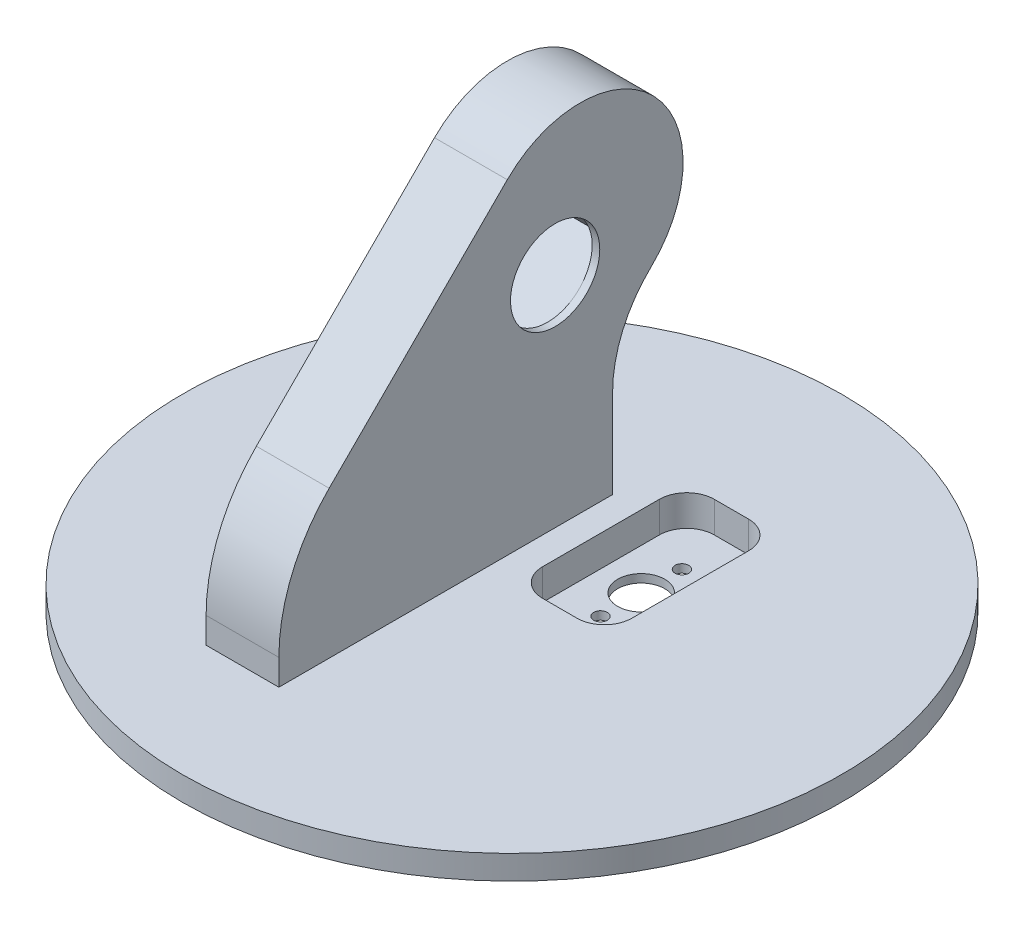
from build123d import *

# Parameters (mm, degrees)
SKETCH2_R           = 48
BOSS_EXTRUDE1_DEPTH = 3.5
BOSS_EXTRUDE2_DEPTH = 10.6
SKETCH31_R          = 6.5
CUT_EXTRUDE18_DEPTH = 94.671540859
CUT_EXTRUDE19_DEPTH = 9.5
SKETCH32_R          = 1
CUT_EXTRUDE20_DEPTH = 4.5
SKETCH33_R          = 43.5
BOSS_EXTRUDE3_DEPTH = 2.2
SKETCH34_W          = 13
SKETCH34_H          = 25
CUT_EXTRUDE21_DEPTH = 4.5
SKETCH35_R          = 3.43
CUT_EXTRUDE22_DEPTH = 146.83305399
FILLET1_R           = 4
SKETCH36_R          = 1
CUT_EXTRUDE23_DEPTH = 10


with BuildPart() as part:
    # Sketch2 → Boss-Extrude1 (new body)
    with BuildSketch(Plane(origin=(0, 0, 0), x_dir=(1, 0, 0), z_dir=(0, 1, 0))):
        Circle(SKETCH2_R)
    extrude(amount=BOSS_EXTRUDE1_DEPTH)

    # Sketch7 → Boss-Extrude2 (add)
    with BuildSketch(Plane(origin=(-4, 0, 0), x_dir=(0, 0, -1), z_dir=(1, 0, 0))):
        with BuildLine():
            Line((18.652115716, 3.5), (18.652115716, 16.356133126))
            ThreePointArc((18.652115716, 16.356133126), (20.111216245, 23.455333411), (24.251965127, 29.403595153))
            ThreePointArc((24.251965127, 29.403595153), (24.659117989, 50.747356958), (3.311904584, 50.883081894))
            Line((3.311904584, 50.883081894), (-22.631121669, 24.94005564))
            ThreePointArc((-22.631121669, 24.94005564), (-28.050440452, 16.82947192), (-29.95345214, 7.262386111))
            Line((-29.95345214, 7.262386111), (-29.95345214, 3.5))
            Line((-29.95345214, 3.5), (18.652115716, 3.5))
        make_face()
    extrude(amount=-BOSS_EXTRUDE2_DEPTH)

    # Sketch31 → Cut-Extrude18 (cut, through all)
    with BuildSketch(Plane(origin=(-14.6, 10.461755651, -5.359516796), x_dir=(0, 0, 1), z_dir=(-1, 0, 0))):
        with Locations((-4.922469695, 24.905412087)):
            Circle(SKETCH31_R)
    extrude(amount=-CUT_EXTRUDE18_DEPTH, mode=Mode.SUBTRACT)

    # Sketch31<3> → Cut-Extrude19 (cut)
    with BuildSketch(Plane(origin=(-14.6, 10.461755651, -5.359516796), x_dir=(0, 0, 1), z_dir=(-1, 0, 0))):
        Polygon((-5.41546104, 34.054639751), (11.74960782, 18.74580534), (3.09678837, 9.043809897), (-14.06828049, 24.352644308), align=None)
    extrude(amount=-CUT_EXTRUDE19_DEPTH, mode=Mode.SUBTRACT)

    # Sketch32 → Cut-Extrude20 (cut)
    with BuildSketch(Plane.ZY.offset(14.6)):
        with Locations((-17.080620038, 41.264504586)):
            Circle(SKETCH32_R)
        with Locations((3.929449654, 22.692559529)):
            Circle(SKETCH32_R)
    extrude(amount=-CUT_EXTRUDE20_DEPTH, mode=Mode.SUBTRACT)

    # Sketch33 → Boss-Extrude3 (add)
    with BuildSketch(Plane.XZ):
        Circle(SKETCH33_R)
    extrude(amount=BOSS_EXTRUDE3_DEPTH)

    # Sketch34 → Cut-Extrude21 (cut)
    with BuildSketch(Plane(origin=(0, 3.5, 0), x_dir=(1, 0, 0), z_dir=(0, 1, 0))):
        with Locations((6.5, 12.963321523)):
            Rectangle(SKETCH34_W, SKETCH34_H)
    extrude(amount=-CUT_EXTRUDE21_DEPTH, mode=Mode.SUBTRACT)

    # Sketch35 → Cut-Extrude22 (cut, through all)
    with BuildSketch(Plane(origin=(70.696833098, 3.5, -19.063682787), x_dir=(1, 0, 0), z_dir=(0, 1, 0))):
        with Locations((-64.72218685, -6.218288812)):
            Circle(SKETCH35_R)
    extrude(amount=-CUT_EXTRUDE22_DEPTH, mode=Mode.SUBTRACT)

    # Fillet1
    fillet1_edges = [part.edges().sort_by_distance(p)[0] for p in [
        (13, 1.25, -0.463321523),
        (0, 1.25, -0.463321523),
        (13, 1.25, -25.463321523),
        (0, 1.25, -25.463321523),
    ]]
    fillet(fillet1_edges, radius=FILLET1_R)

    # Sketch36 → Cut-Extrude23 (cut)
    with BuildSketch(Plane(origin=(0, -1, 0), x_dir=(1, 0, 0), z_dir=(0, 1, 0))):
        with Locations((5.974646248, 18.775393975)):
            Circle(SKETCH36_R)
        with Locations((5.974646248, 6.915393975)):
            Circle(SKETCH36_R)
    extrude(amount=-CUT_EXTRUDE23_DEPTH, mode=Mode.SUBTRACT)


solid = part.part
